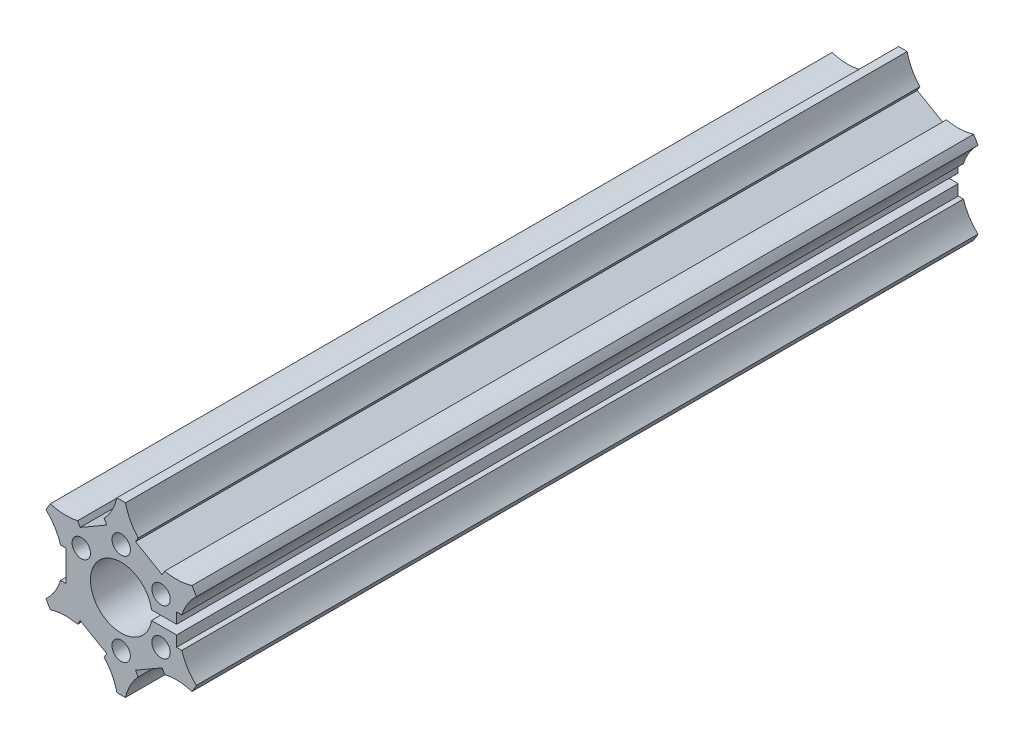
from build123d import *

# Parameters (mm, degrees)
BOSS_EXTRU_1_DEPTH      = 254.666666667
ESQUISSE4_R             = 54.250129783
ESQUISSE4_R_2           = 27.5
ENL_V_MAT_EXTRU_1_DEPTH = 266.174026394
ESQUISSE5_R             = 10
ESQUISSE5_R_2           = 3
ESQUISSE5_W             = 1.7
ESQUISSE5_H             = 10
ENL_V_MAT_EXTRU_2_DEPTH = 258.315177949
ENL_V_MAT_EXTRU_3_REACH = 261.031
ESQUISSE7_W             = 15
ESQUISSE7_H             = 3


with BuildPart() as part:
    # Esquisse1 → Boss.-Extru.1 (new body)
    with BuildSketch(Plane.XY):
        with BuildLine():
            Line((-18, -51.176914536), (-18, -48.176914536))
            ThreePointArc((-18, -48.176914536), (-9.5, -16.454482672), (-32.722431864, -39.676914536))
            Line((-32.722431864, -39.676914536), (-35.320508076, -41.176914536))
            ThreePointArc((-35.320508076, -41.176914536), (-37.98683472, -30.451354144), (-34.549834435, -19.947356212))
            ThreePointArc((-34.549834435, -19.947356212), (-45.365063628, -17.671886805), (-53.320508076, -10))
            Line((-53.320508076, -10), (-50.722431864, -8.5))
            ThreePointArc((-50.722431864, -8.5), (-19, 0), (-50.722431864, 8.5))
            Line((-50.722431864, 8.5), (-53.320508076, 10))
            ThreePointArc((-53.320508076, 10), (-45.365063628, 17.671886805), (-34.549834435, 19.947356212))
            ThreePointArc((-34.549834435, 19.947356212), (-37.98683472, 30.451354144), (-35.320508076, 41.176914536))
            Line((-35.320508076, 41.176914536), (-32.722431864, 39.676914536))
            ThreePointArc((-32.722431864, 39.676914536), (-9.5, 16.454482672), (-18, 48.176914536))
            Line((-18, 48.176914536), (-18, 51.176914536))
            ThreePointArc((-18, 51.176914536), (-7.378228908, 48.123240948), (0, 39.894712423))
            ThreePointArc((0, 39.894712423), (7.378228908, 48.123240948), (18, 51.176914536))
            Line((18, 51.176914536), (18, 48.176914536))
            ThreePointArc((18, 48.176914536), (9.5, 16.454482672), (32.722431864, 39.676914536))
            Line((32.722431864, 39.676914536), (35.320508076, 41.176914536))
            ThreePointArc((35.320508076, 41.176914536), (37.98683472, 30.451354144), (34.549834435, 19.947356212))
            ThreePointArc((34.549834435, 19.947356212), (45.365063628, 17.671886805), (53.320508076, 10))
            Line((53.320508076, 10), (50.722431864, 8.5))
            ThreePointArc((50.722431864, 8.5), (19, 0), (50.722431864, -8.5))
            Line((50.722431864, -8.5), (53.320508076, -10))
            ThreePointArc((53.320508076, -10), (45.365063628, -17.671886805), (34.549834435, -19.947356212))
            ThreePointArc((34.549834435, -19.947356212), (37.98683472, -30.451354144), (35.320508076, -41.176914536))
            Line((35.320508076, -41.176914536), (32.722431864, -39.676914536))
            ThreePointArc((32.722431864, -39.676914536), (9.5, -16.454482672), (18, -48.176914536))
            Line((18, -48.176914536), (18, -51.176914536))
            ThreePointArc((18, -51.176914536), (7.378228908, -48.123240948), (0, -39.894712423))
            ThreePointArc((0, -39.894712423), (-7.378228908, -48.123240948), (-18, -51.176914536))
        make_face()
    extrude(amount=BOSS_EXTRU_1_DEPTH)

    # Esquisse4 → Enlèv. mat.-Extru.1 (cut, through all)
    with BuildSketch(Plane.XY.offset(254.666666667)):
        Circle(ESQUISSE4_R)
        Circle(ESQUISSE4_R_2, mode=Mode.SUBTRACT)
    extrude(amount=-ENL_V_MAT_EXTRU_1_DEPTH, mode=Mode.SUBTRACT)

    # Esquisse5 → Enlèv. mat.-Extru.2 (cut, through all)
    with BuildSketch(Plane.XY.offset(254.666666667)):
        Circle(ESQUISSE5_R)
        with Locations((0, 15)):
            Circle(ESQUISSE5_R_2)
        with Locations((12.990381057, 7.5)):
            Circle(ESQUISSE5_R_2)
        with Locations((12.990381057, -7.5)):
            Circle(ESQUISSE5_R_2)
        with Locations((0, -15)):
            Circle(ESQUISSE5_R_2)
        with Locations((-12.990381057, 7.5)):
            Circle(ESQUISSE5_R_2)
        Polygon((14.206088614, -14.605667257), (5.545834576, -19.605667257), (4.695834576, -18.13342407), (13.356088614, -13.13342407), align=None)
        Polygon((18.051923191, 5), (19.751923191, 5), (19.751923191, -5), (18.051923191, -5), (18.051923191, -1.5), (14.051923191, -1.5), (14.051923191, 1.5), (18.051923191, 1.5), align=None)
        Polygon((-5.545834576, -19.605667257), (-14.206088614, -14.605667257), (-13.356088614, -13.13342407), (-4.695834576, -18.13342407), align=None)
        with Locations((-18.901923191, 0)):
            Rectangle(ESQUISSE5_W, ESQUISSE5_H)
        Polygon((-14.206088614, 14.605667257), (-5.545834576, 19.605667257), (-4.695834576, 18.13342407), (-13.356088614, 13.13342407), align=None)
        Polygon((5.545834576, 19.605667257), (14.206088614, 14.605667257), (13.356088614, 13.13342407), (4.695834576, 18.13342407), align=None)
    extrude(amount=-ENL_V_MAT_EXTRU_2_DEPTH, mode=Mode.SUBTRACT)

    # Esquisse7 → Enlèv. mat.-Extru.3 (cut, up to next)
    with BuildSketch(Plane(origin=(14.051923191, 0, 0), x_dir=(0, 0, -1), z_dir=(1, 0, 0)), mode=Mode.PRIVATE) as enl_v_mat_extru_3_sk1:
        with Locations((-247.166666667, 0)):
            Rectangle(ESQUISSE7_W, ESQUISSE7_H)
    enl_v_mat_extru_3_tool1 = extrude(enl_v_mat_extru_3_sk1.sketch, amount=-ENL_V_MAT_EXTRU_3_REACH, mode=Mode.PRIVATE) & part.part
    # Esquisse7 → Enlèv. mat.-Extru.3 (cut, up to next)
    with BuildSketch(Plane(origin=(14.051923191, 0, 0), x_dir=(0, 0, -1), z_dir=(1, 0, 0)), mode=Mode.PRIVATE) as enl_v_mat_extru_3_sk2:
        with Locations((-7.5, 0)):
            Rectangle(ESQUISSE7_W, ESQUISSE7_H)
    enl_v_mat_extru_3_tool2 = extrude(enl_v_mat_extru_3_sk2.sketch, amount=-ENL_V_MAT_EXTRU_3_REACH, mode=Mode.PRIVATE) & part.part
    add(enl_v_mat_extru_3_tool1.solids().sort_by_distance((14.051923, 0, 247.166667))[0], mode=Mode.SUBTRACT)
    add(enl_v_mat_extru_3_tool2.solids().sort_by_distance((14.051923, 0, 7.5))[0], mode=Mode.SUBTRACT)


solid = part.part
